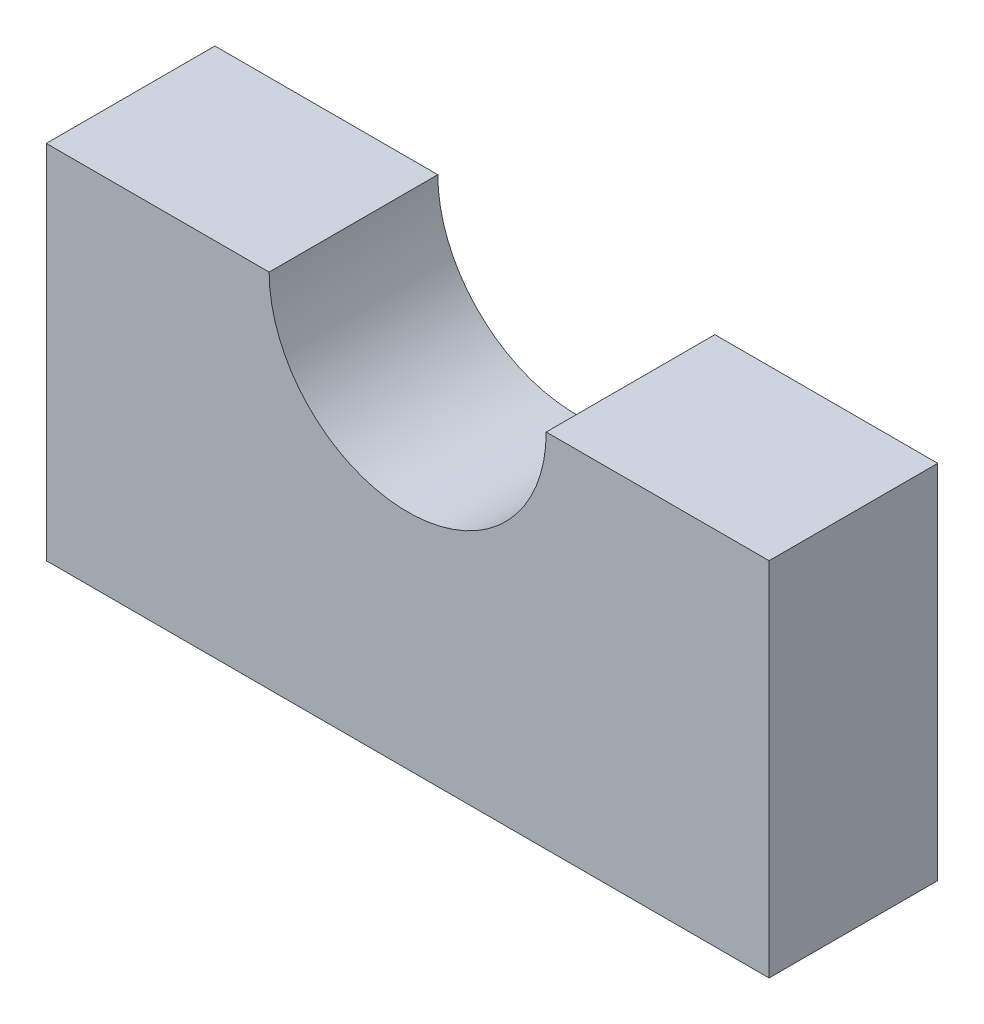
from build123d import *

# Parameters (mm, degrees)
BOSS_EXTRUDE1_DEPTH = 17.78


with BuildPart() as part:
    # Sketch1 → Boss-Extrude1 (new body)
    with BuildSketch(Plane.XY):
        with BuildLine():
            Line((-38.1, 0), (-38.1, -38.1))
            Line((-38.1, -38.1), (38.1, -38.1))
            Line((38.1, -38.1), (38.1, 0))
            Line((38.1, 0), (14.605, 0))
            ThreePointArc((14.605, 0), (0, -14.605), (-14.605, 0))
            Line((-14.605, 0), (-38.1, 0))
        make_face()
    extrude(amount=BOSS_EXTRUDE1_DEPTH)


solid = part.part
